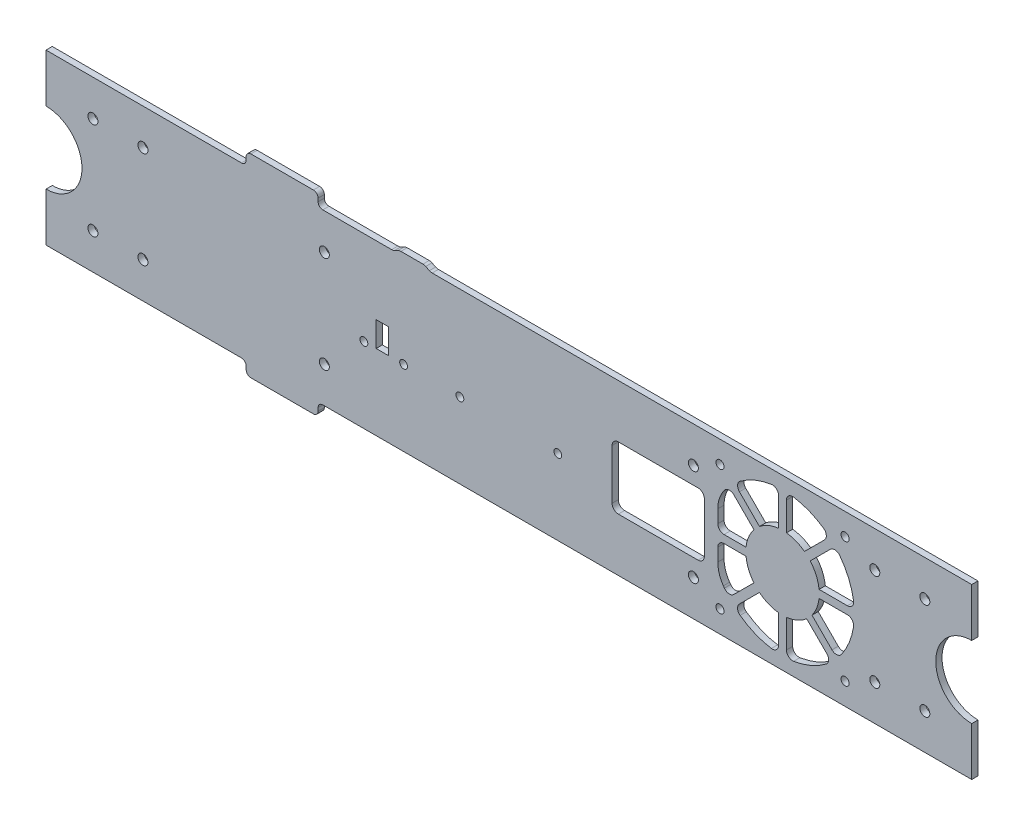
from build123d import *

# Parameters (mm, degrees)
SZKIC1_R                    = 1.6
SZKIC1_R_2                  = 1.25
SZKIC1_R_3                  = 1.3
SZKIC1_W                    = 4
SZKIC1_H                    = 8
DODANIE_WYCI_GNI_CIE2_DEPTH = 2


with BuildPart() as part:
    # Szkic1 → Dodanie-wyciągnięcie2 (new body)
    with BuildSketch(Plane.XY):
        with BuildLine():
            Line((-157.380716887, 25.008270361), (-157.380716887, 9.508270361))
            ThreePointArc((-157.380716887, 9.508270361), (-145.880716887, -1.991729639), (-157.380716887, -13.491729639))
            Line((-157.380716887, -13.491729639), (-157.380716887, -28.991729639))
            Line((-157.380716887, -28.991729639), (-94.880716887, -28.991729639))
            ThreePointArc((-94.880716887, -28.991729639), (-93.820056715, -29.431069467), (-93.380716887, -30.491729639))
            Line((-93.380716887, -30.491729639), (-93.380716887, -31.491729639))
            ThreePointArc((-93.380716887, -31.491729639), (-92.941377059, -32.55238981), (-91.880716887, -32.991729639))
            Line((-91.880716887, -32.991729639), (-71.880716887, -32.991729639))
            ThreePointArc((-71.880716887, -32.991729639), (-70.820056715, -32.55238981), (-70.380716887, -31.491729639))
            Line((-70.380716887, -31.491729639), (-70.380716887, -30.491729639))
            ThreePointArc((-70.380716887, -30.491729639), (-69.941377059, -29.431069467), (-68.880716887, -28.991729639))
            Line((-68.880716887, -28.991729639), (-54.387814563, -28.991729639))
            Line((-54.387814563, -28.991729639), (10.612185437, -28.991729639))
            Line((10.612185437, -28.991729639), (49.612185437, -28.991729639))
            Line((49.612185437, -28.991729639), (76.612185437, -28.991729639))
            Line((76.612185437, -28.991729639), (138.619283113, -28.991729639))
            Line((138.619283113, -28.991729639), (138.619283113, -13.491729639))
            ThreePointArc((138.619283113, -13.491729639), (127.119283113, -1.991729639), (138.619283113, 9.508270361))
            Line((138.619283113, 9.508270361), (138.619283113, 25.008270361))
            Line((138.619283113, 25.008270361), (76.612185437, 25.008270361))
            Line((76.612185437, 25.008270361), (49.612185437, 25.008270361))
            Line((49.612185437, 25.008270361), (-33.908460747, 25.008270361))
            ThreePointArc((-33.908460747, 25.008270361), (-34.367966589, 25.061772382), (-34.802887938, 25.219415979))
            Line((-34.802887938, 25.219415979), (-35.958305466, 25.797124743))
            ThreePointArc((-35.958305466, 25.797124743), (-36.393226816, 25.95476834), (-36.852732657, 26.008270361))
            Line((-36.852732657, 26.008270361), (-43.908460747, 26.008270361))
            ThreePointArc((-43.908460747, 26.008270361), (-44.367966589, 25.95476834), (-44.802887938, 25.797124743))
            Line((-44.802887938, 25.797124743), (-45.958305466, 25.219415979))
            ThreePointArc((-45.958305466, 25.219415979), (-46.393226816, 25.061772382), (-46.852732657, 25.008270361))
            Line((-46.852732657, 25.008270361), (-68.880716887, 25.008270361))
            ThreePointArc((-68.880716887, 25.008270361), (-69.941377059, 25.44761019), (-70.380716887, 26.508270361))
            Line((-70.380716887, 26.508270361), (-70.380716887, 27.508270361))
            ThreePointArc((-70.380716887, 27.508270361), (-70.820056715, 28.568930533), (-71.880716887, 29.008270361))
            Line((-71.880716887, 29.008270361), (-91.880716887, 29.008270361))
            ThreePointArc((-91.880716887, 29.008270361), (-92.941377059, 28.568930533), (-93.380716887, 27.508270361))
            Line((-93.380716887, 27.508270361), (-93.380716887, 26.508270361))
            ThreePointArc((-93.380716887, 26.508270361), (-93.820056715, 25.44761019), (-94.880716887, 25.008270361))
            Line((-94.880716887, 25.008270361), (-157.380716887, 25.008270361))
        make_face()
        with Locations((-126.387814563, -17.491729639)):
            Circle(SZKIC1_R, mode=Mode.SUBTRACT)
        with Locations((-126.380716887, 13.508270361)):
            Circle(SZKIC1_R, mode=Mode.SUBTRACT)
        with Locations((107.619283113, -17.491729639)):
            Circle(SZKIC1_R, mode=Mode.SUBTRACT)
        with Locations((107.619283113, 13.508270361)):
            Circle(SZKIC1_R, mode=Mode.SUBTRACT)
        with Locations((123.619283113, -17.491729639)):
            Circle(SZKIC1_R, mode=Mode.SUBTRACT)
        with Locations((123.619283113, 13.508270361)):
            Circle(SZKIC1_R, mode=Mode.SUBTRACT)
        with Locations((-142.387814563, -17.491728826)):
            Circle(SZKIC1_R, mode=Mode.SUBTRACT)
        with Locations((-142.380716887, 13.508270361)):
            Circle(SZKIC1_R, mode=Mode.SUBTRACT)
        with Locations((-43.037814563, -4.85389443)):
            Circle(SZKIC1_R_2, mode=Mode.SUBTRACT)
        with Locations((-25.037814563, -4.85389443)):
            Circle(SZKIC1_R_2, mode=Mode.SUBTRACT)
        with Locations((6.262185437, -4.85389443)):
            Circle(SZKIC1_R_2, mode=Mode.SUBTRACT)
        with Locations((58.119283113, -21.991729639)):
            Circle(SZKIC1_R_3, mode=Mode.SUBTRACT)
        with Locations((98.119283113, -21.991729639)):
            Circle(SZKIC1_R_3, mode=Mode.SUBTRACT)
        with Locations((98.119283113, 18.008270361)):
            Circle(SZKIC1_R_3, mode=Mode.SUBTRACT)
        with Locations((58.119283113, 18.008270361)):
            Circle(SZKIC1_R_3, mode=Mode.SUBTRACT)
        with Locations((-68.387814563, -17.491729639)):
            Circle(SZKIC1_R, mode=Mode.SUBTRACT)
        with Locations((-68.380716887, 13.508270361)):
            Circle(SZKIC1_R, mode=Mode.SUBTRACT)
        with Locations((49.619283113, -17.491729639)):
            Circle(SZKIC1_R, mode=Mode.SUBTRACT)
        with Locations((49.619283113, 13.508270361)):
            Circle(SZKIC1_R, mode=Mode.SUBTRACT)
        with Locations((-55.737814563, -4.85389443)):
            Circle(SZKIC1_R_2, mode=Mode.SUBTRACT)
        with BuildLine():
            Line((79.369283113, 18.747494491), (79.369283113, 9.691591807))
            ThreePointArc((79.369283113, 9.691591807), (82.405338502, 8.948664742), (85.138104215, 7.43157394))
            Line((85.138104215, 7.43157394), (91.534522364, 13.826808518))
            ThreePointArc((91.534522364, 13.826808518), (92.112613145, 15.41791494), (91.263406951, 16.882379838))
            ThreePointArc((91.263406951, 16.882379838), (86.693890561, 19.350156574), (81.687208557, 20.729843987))
            ThreePointArc((81.687208557, 20.729843987), (80.07170559, 20.272493498), (79.369283113, 18.747494491))
        make_face(mode=Mode.SUBTRACT)
        with BuildLine():
            Line((76.869283113, 18.755602068), (76.869283113, 9.691591807))
            ThreePointArc((76.869283113, 9.691591807), (73.623255004, 8.864062882), (70.74265698, 7.154192234))
            Line((70.74265698, 7.154192234), (64.334270116, 13.563765103))
            ThreePointArc((64.334270116, 13.563765103), (63.754662098, 15.133262474), (64.570455611, 16.59399804))
            ThreePointArc((64.570455611, 16.59399804), (69.31872127, 19.257978859), (74.560131496, 20.731219989))
            ThreePointArc((74.560131496, 20.731219989), (76.169581668, 20.275079557), (76.869283113, 18.755602068))
        make_face(mode=Mode.SUBTRACT)
        with BuildLine():
            Line((98.858507242, -0.741729639), (89.802604559, -0.741729639))
            ThreePointArc((89.802604559, -0.741729639), (88.886384975, 2.712738185), (86.974050544, 5.731973732))
            Line((86.974050544, 5.731973732), (93.402138562, 12.158872319))
            ThreePointArc((93.402138562, 12.158872319), (94.949975464, 12.740050352), (96.406405851, 11.95750482))
            ThreePointArc((96.406405851, 11.95750482), (99.270434112, 7.043136792), (100.840856739, 1.576195805))
            ThreePointArc((100.840856739, 1.576195805), (100.38350625, -0.039307162), (98.858507242, -0.741729639))
        make_face(mode=Mode.SUBTRACT)
        with BuildLine():
            Line((98.859839097, -3.241729639), (89.802604559, -3.241729639))
            ThreePointArc((89.802604559, -3.241729639), (89.057826369, -6.282507125), (87.536523736, -9.018683392))
            Line((87.536523736, -9.018683392), (93.931991894, -15.415335164))
            ThreePointArc((93.931991894, -15.415335164), (95.522614645, -15.993468801), (96.987008035, -15.145016539))
            ThreePointArc((96.987008035, -15.145016539), (99.459359071, -10.570841371), (100.841083042, -5.558213618))
            ThreePointArc((100.841083042, -5.558213618), (100.383931089, -3.943705039), (98.859839097, -3.241729639))
        make_face(mode=Mode.SUBTRACT)
        with BuildLine():
            Line((66.435961668, -0.741729639), (59.419283113, -0.741729639))
            ThreePointArc((59.419283113, -0.741729639), (58.005069551, -0.155943201), (57.419283113, 1.258270361))
            Line((57.419283113, 1.258270361), (57.419283113, 5.391359146))
            ThreePointArc((57.419283113, 5.391359146), (57.871830775, 8.365607597), (59.188513882, 11.070658211))
            ThreePointArc((59.188513882, 11.070658211), (59.360689238, 11.316732174), (59.536063013, 11.560536987))
            ThreePointArc((59.536063013, 11.560536987), (60.996949519, 12.376060173), (62.566339604, 11.796161723))
            Line((62.566339604, 11.796161723), (68.974726469, 5.386588854))
            ThreePointArc((68.974726469, 5.386588854), (67.263906643, 2.505302903), (66.435961668, -0.741729639))
        make_face(mode=Mode.SUBTRACT)
        with BuildLine():
            Line((76.869283113, -13.675051084), (76.869283113, -22.732285623))
            ThreePointArc((76.869283113, -22.732285623), (76.167307713, -24.256377614), (74.552799133, -24.713529568))
            ThreePointArc((74.552799133, -24.713529568), (69.308187359, -23.23707246), (64.558027599, -20.568391041))
            ThreePointArc((64.558027599, -20.568391041), (63.743248609, -19.107592513), (64.323184505, -17.538684771))
            Line((64.323184505, -17.538684771), (70.733111198, -11.129944149))
            ThreePointArc((70.733111198, -11.129944149), (73.617588025, -12.845173393), (76.869283113, -13.675051084))
        make_face(mode=Mode.SUBTRACT)
        with BuildLine():
            Line((79.369283113, -13.675051084), (79.369283113, -22.732285623))
            ThreePointArc((79.369283113, -22.732285623), (80.071258513, -24.256377614), (81.685767093, -24.713529568))
            ThreePointArc((81.685767093, -24.713529568), (87.148377668, -23.145345205), (92.059696026, -20.285577999))
            ThreePointArc((92.059696026, -20.285577999), (92.842976336, -18.829043994), (92.261830617, -17.280725872))
            Line((92.261830617, -17.280725872), (85.83540153, -10.853107442))
            ThreePointArc((85.83540153, -10.853107442), (82.819140701, -12.760844674), (79.369283113, -13.675051084))
        make_face(mode=Mode.SUBTRACT)
        with BuildLine():
            Line((66.435961668, -3.241729639), (59.419283113, -3.241729639))
            ThreePointArc((59.419283113, -3.241729639), (58.005069551, -3.827516076), (57.419283113, -5.241729639))
            Line((57.419283113, -5.241729639), (57.419283113, -9.374818423))
            ThreePointArc((57.419283113, -9.374818423), (57.871830775, -12.349066874), (59.188513882, -15.054117488))
            ThreePointArc((59.188513882, -15.054117488), (59.356239368, -15.29391703), (59.527002255, -15.531563185))
            ThreePointArc((59.527002255, -15.531563185), (60.987825298, -16.348101127), (62.557805033, -15.768530764))
            Line((62.557805033, -15.768530764), (68.967026729, -9.360495008))
            ThreePointArc((68.967026729, -9.360495008), (67.261560134, -6.483093764), (66.435961668, -3.241729639))
        make_face(mode=Mode.SUBTRACT)
        with BuildLine():
            Line((25.619283113, 8.008270361), (51.119283113, 8.008270361))
            ThreePointArc((51.119283113, 8.008270361), (52.533496676, 7.422483924), (53.119283113, 6.008270361))
            Line((53.119283113, 6.008270361), (53.119283113, -9.991729639))
            ThreePointArc((53.119283113, -9.991729639), (52.533496676, -11.405943201), (51.119283113, -11.991729639))
            Line((51.119283113, -11.991729639), (25.619283113, -11.991729639))
            ThreePointArc((25.619283113, -11.991729639), (24.205069551, -11.405943201), (23.619283113, -9.991729639))
            Line((23.619283113, -9.991729639), (23.619283113, 6.008270361))
            ThreePointArc((23.619283113, 6.008270361), (24.205069551, 7.422483924), (25.619283113, 8.008270361))
        make_face(mode=Mode.SUBTRACT)
        with Locations((-49.830596702, -0.85389443)):
            Rectangle(SZKIC1_W, SZKIC1_H, mode=Mode.SUBTRACT)
    extrude(amount=DODANIE_WYCI_GNI_CIE2_DEPTH)


solid = part.part
